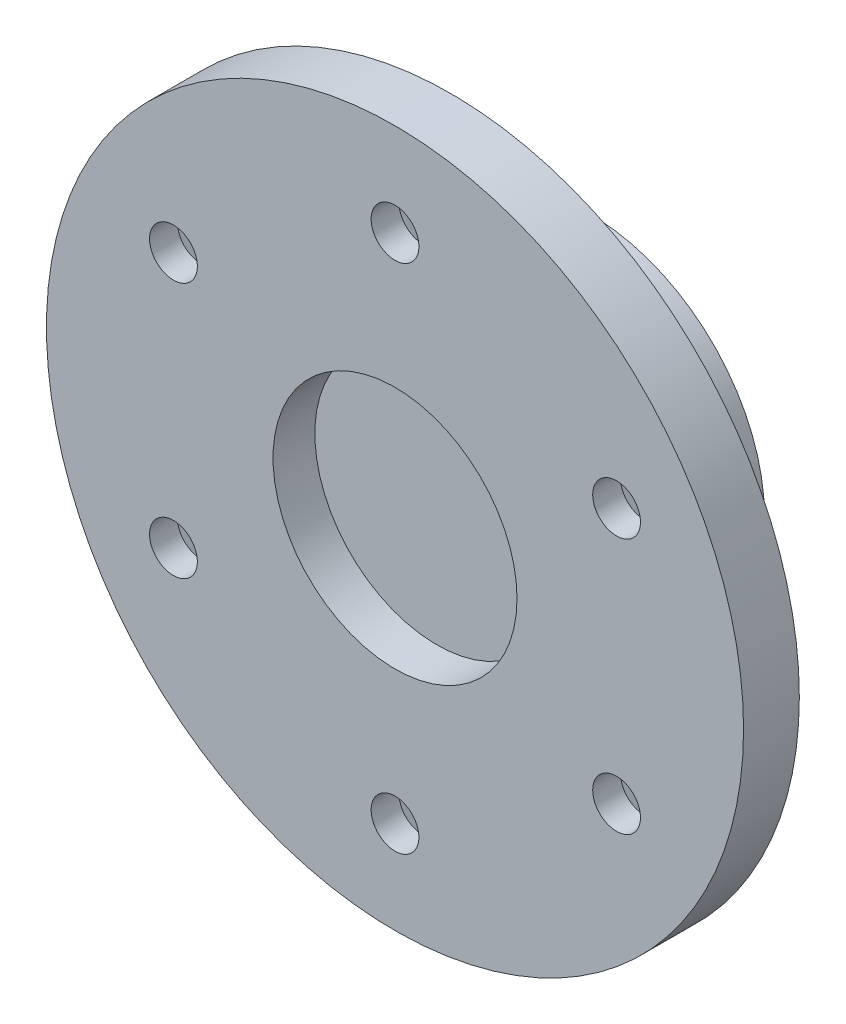
from build123d import *

# Parameters (mm, degrees)
SKETCH1_R               = 25
BOSS_EXTRUDE1_DEPTH     = 4
SKETCH2_R               = 1.713577746
CUT_EXTRUDE1_DEPTH      = 4
CUT_EXTRUDE2_DEPTH      = 2
SKETCH4_R               = 12.5
SKETCH4_R_2             = 2.5
BOSS_EXTRUDE2_DEPTH     = 10
SKETCH5_R               = 1.6
CUT_EXTRUDE3_DEPTH      = 12.5
SKETCH6_R               = 3.1
CUT_EXTRUDE4_DEPTH      = 6
FILLET1_R               = 1.5
SKETCH9_R               = 8.75
CUT_EXTRUDE6_DEPTH      = 3
SKETCH12_W              = 5.5
SKETCH12_H              = 2.5
CUT_EXTRUDE7_DEPTH      = 10
CUT_EXTRUDE8_DEPTH      = 10
CUT_EXTRUDE8_DEPTH_BACK = 2
SKETCH17_R              = 1.6
CUT_EXTRUDE9_DEPTH      = 30
CUT_EXTRUDE9_DEPTH_BACK = 2
CUT_EXTRUDE10_START     = -3
SKETCH20_R              = 3.1
CUT_EXTRUDE10_DEPTH     = 4
CUT_EXTRUDE11_START     = -3
SKETCH21_R              = 3.1
CUT_EXTRUDE11_DEPTH     = 4


with BuildPart() as part:
    # Sketch1 → Boss-Extrude1 (new body)
    with BuildSketch(Plane.XY):
        Circle(SKETCH1_R)
    extrude(amount=BOSS_EXTRUDE1_DEPTH)

    # Sketch2 → Cut-Extrude1 (cut)
    with BuildSketch(Plane(origin=(0, 0, 0), x_dir=(-1, 0, 0), z_dir=(0, 0, -1))):
        with Locations((0, 18.35)):
            Circle(SKETCH2_R)
        with Locations((15.891566159, 9.175)):
            Circle(SKETCH2_R)
        with Locations((15.891566159, -9.175)):
            Circle(SKETCH2_R)
        with Locations((0, -18.35)):
            Circle(SKETCH2_R)
        with Locations((-15.891566159, -9.175)):
            Circle(SKETCH2_R)
        with Locations((-15.891566159, 9.175)):
            Circle(SKETCH2_R)
    extrude(amount=-CUT_EXTRUDE1_DEPTH, mode=Mode.SUBTRACT)

    # Sketch3 → Cut-Extrude2 (cut)
    with BuildSketch(Plane(origin=(0, 0, 0), x_dir=(-1, 0, 0), z_dir=(0, 0, -1))):
        Polygon((13.72650265, 5.425), (18.056629669, 5.425), (20.221693178, 9.175), (18.056629669, 12.925), (13.72650265, 12.925), (11.561439141, 9.175), align=None)
        Polygon((4.330127019, 18.35), (2.165063509, 22.1), (-2.165063509, 22.1), (-4.330127019, 18.35), (-2.165063509, 14.6), (2.165063509, 14.6), align=None)
        Polygon((11.561439141, -9.175), (13.72650265, -12.925), (18.056629669, -12.925), (20.221693178, -9.175), (18.056629669, -5.425), (13.72650265, -5.425), align=None)
        Polygon((-2.165063509, -14.6), (-4.330127019, -18.35), (-2.165063509, -22.1), (2.165063509, -22.1), (4.330127019, -18.35), (2.165063509, -14.6), align=None)
        Polygon((-13.72650265, -5.425), (-18.056629669, -5.425), (-20.221693178, -9.175), (-18.056629669, -12.925), (-13.72650265, -12.925), (-11.561439141, -9.175), align=None)
        Polygon((-11.561439141, 9.175), (-13.72650265, 12.925), (-18.056629669, 12.925), (-20.221693178, 9.175), (-18.056629669, 5.425), (-13.72650265, 5.425), align=None)
    extrude(amount=-CUT_EXTRUDE2_DEPTH, mode=Mode.SUBTRACT)

    # Sketch4 → Boss-Extrude2 (add)
    with BuildSketch(Plane(origin=(0, 0, 0), x_dir=(-1, 0, 0), z_dir=(0, 0, -1))):
        Circle(SKETCH4_R)
        with Locations((0, 0.5)):
            Circle(SKETCH4_R_2, mode=Mode.SUBTRACT)
    extrude(amount=BOSS_EXTRUDE2_DEPTH)

    # Sketch5 → Cut-Extrude3 (cut)
    with BuildSketch(Plane(origin=(0, 12.5, 0), x_dir=(1, 0, 0), z_dir=(0, 1, 0))):
        with Locations((0, 5)):
            Circle(SKETCH5_R)
    extrude(amount=-CUT_EXTRUDE3_DEPTH, mode=Mode.SUBTRACT)

    # Sketch6 → Cut-Extrude4 (cut)
    with BuildSketch(Plane(origin=(0, 12.5, 0), x_dir=(1, 0, 0), z_dir=(0, 1, 0))):
        with Locations((0, 5)):
            Circle(SKETCH6_R)
    extrude(amount=-CUT_EXTRUDE4_DEPTH, mode=Mode.SUBTRACT)

    # Fillet1
    fillet1_edges = [part.edges().sort_by_distance(p)[0] for p in [
        (12.5, 0, 0),
    ]]
    fillet(fillet1_edges, radius=FILLET1_R)

    # Sketch9 → Cut-Extrude6 (cut)
    with BuildSketch(Plane.XY.offset(4)):
        Circle(SKETCH9_R)
    extrude(amount=-CUT_EXTRUDE6_DEPTH, mode=Mode.SUBTRACT)

    # Sketch12 → Cut-Extrude7 (cut)
    with BuildSketch(Plane(origin=(0, 0, -10), x_dir=(-1, 0, 0), z_dir=(0, 0, -1))):
        Polygon((1.098076211, -4.098076211), (4.098076211, 1.098076211), (6.479646072, -0.276923789), (3.479646072, -5.473076211), align=None)
        with Locations((0, 3.25)):
            Rectangle(SKETCH12_W, SKETCH12_H)
        Polygon((-3.479646072, -5.473076211), (-1.098076211, -4.098076211), (-4.098076211, 1.098076211), (-6.479646072, -0.276923789), align=None)
    extrude(amount=-CUT_EXTRUDE7_DEPTH, mode=Mode.SUBTRACT)

    # Sketch17 → Cut-Extrude8 (cut, two sides: drawn at the far end of the back side and taken through both)
    with BuildSketch(Plane(origin=(2.598076211, -1.5, 0), x_dir=(0, 0, -1), z_dir=(0.8660254037844387, -0.4999999999999998, 0)).offset(-CUT_EXTRUDE8_DEPTH_BACK)):
        with Locations((5, 0)):
            Circle(SKETCH17_R)
    extrude(amount=CUT_EXTRUDE8_DEPTH + CUT_EXTRUDE8_DEPTH_BACK, mode=Mode.SUBTRACT)

    # Sketch18 → Cut-Extrude9 (cut, two sides: drawn at the far end of the back side and taken through both)
    with BuildSketch(Plane(origin=(-2.598076211, -1.5, 0), x_dir=(0, 0, 1), z_dir=(-0.8660254037844388, -0.49999999999999983, 0)).offset(-CUT_EXTRUDE9_DEPTH_BACK)):
        with BuildLine():
            ThreePointArc((-6.6, 0), (-5, -1.6), (-3.4, 0))
            ThreePointArc((-3.4, 0), (-5, 1.6), (-6.6, 0))
        make_face()
    extrude(amount=CUT_EXTRUDE9_DEPTH + CUT_EXTRUDE9_DEPTH_BACK, mode=Mode.SUBTRACT)

    # Sketch20 → Cut-Extrude10 (cut)
    with BuildSketch(Plane(origin=(-4.979646072, -2.875, 0), x_dir=(0, 0, -1), z_dir=(0.866025403784439, 0.4999999999999994, 0)).offset(CUT_EXTRUDE10_START)):
        with Locations((5, 0)):
            Circle(SKETCH20_R)
    extrude(amount=-CUT_EXTRUDE10_DEPTH, mode=Mode.SUBTRACT)

    # Sketch21 → Cut-Extrude11 (cut)
    with BuildSketch(Plane(origin=(4.979646072, -2.875, 0), x_dir=(0, 0, 1), z_dir=(-0.866025403784439, 0.4999999999999994, 0)).offset(CUT_EXTRUDE11_START)):
        with Locations((-5, 0)):
            Circle(SKETCH21_R)
    extrude(amount=-CUT_EXTRUDE11_DEPTH, mode=Mode.SUBTRACT)


solid = part.part
